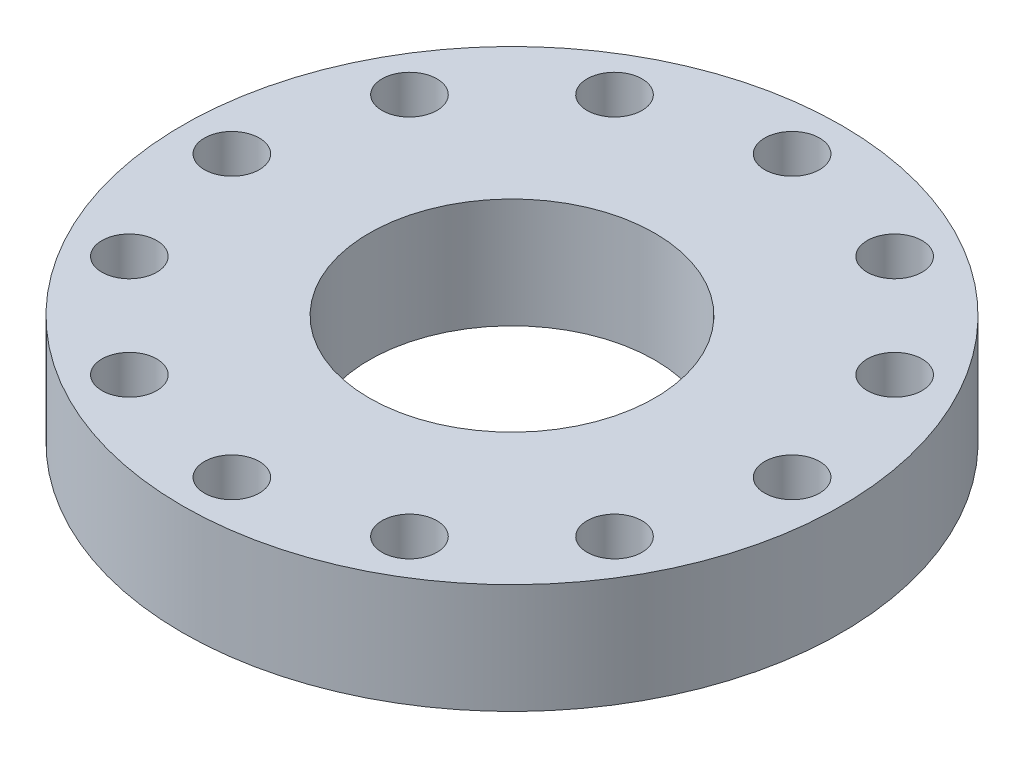
from build123d import *

# Parameters (mm, degrees)
SKETCH1_R           = 30
SKETCH1_R_2         = 2.5
SKETCH1_R_3         = 13
BOSS_EXTRUDE1_DEPTH = 10


with BuildPart() as part:
    # Sketch1 → Boss-Extrude1 (new body)
    with BuildSketch(Plane(origin=(0, 0, 0), x_dir=(1, 0, 0), z_dir=(0, 1, 0))):
        Circle(SKETCH1_R)
        with Locations((0, 25.5)):
            Circle(SKETCH1_R_2, mode=Mode.SUBTRACT)
        with Locations((12.75, 22.083647797)):
            Circle(SKETCH1_R_2, mode=Mode.SUBTRACT)
        with Locations((22.083647797, 12.75)):
            Circle(SKETCH1_R_2, mode=Mode.SUBTRACT)
        with Locations((25.5, 0)):
            Circle(SKETCH1_R_2, mode=Mode.SUBTRACT)
        with Locations((22.083647797, -12.75)):
            Circle(SKETCH1_R_2, mode=Mode.SUBTRACT)
        with Locations((12.75, -22.083647797)):
            Circle(SKETCH1_R_2, mode=Mode.SUBTRACT)
        Circle(SKETCH1_R_3, mode=Mode.SUBTRACT)
        with Locations((0, -25.5)):
            Circle(SKETCH1_R_2, mode=Mode.SUBTRACT)
        with Locations((-12.75, -22.083647797)):
            Circle(SKETCH1_R_2, mode=Mode.SUBTRACT)
        with Locations((-22.083647797, -12.75)):
            Circle(SKETCH1_R_2, mode=Mode.SUBTRACT)
        with Locations((-25.5, 0)):
            Circle(SKETCH1_R_2, mode=Mode.SUBTRACT)
        with Locations((-22.083647797, 12.75)):
            Circle(SKETCH1_R_2, mode=Mode.SUBTRACT)
        with Locations((-12.75, 22.083647797)):
            Circle(SKETCH1_R_2, mode=Mode.SUBTRACT)
    extrude(amount=BOSS_EXTRUDE1_DEPTH)


solid = part.part
